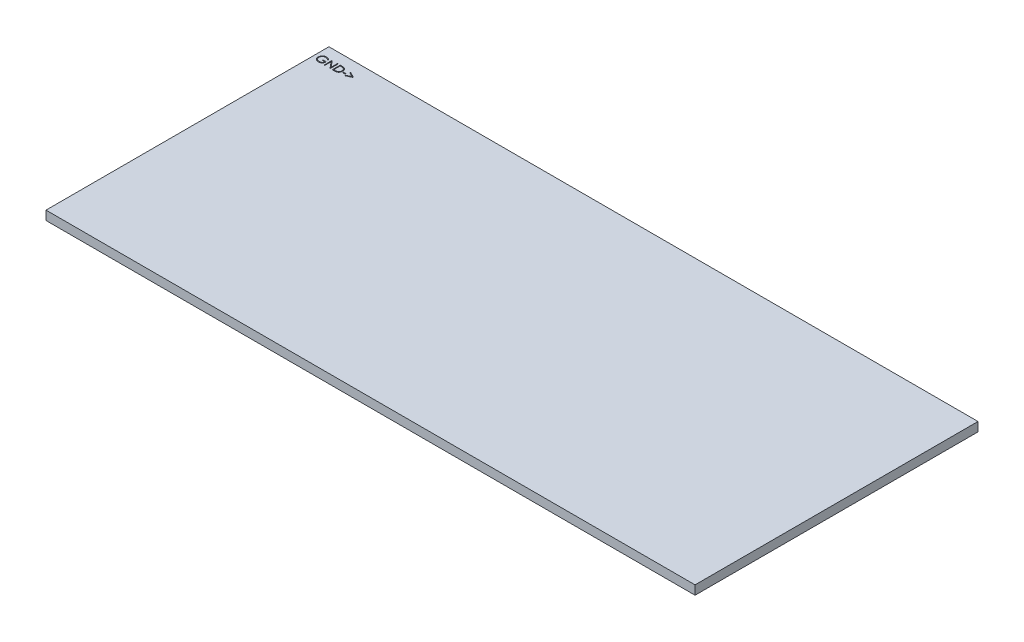
from build123d import *

# Parameters (mm, degrees)
SKETCH1_W           = 114.2
SKETCH1_H           = 49.784
BOSS_EXTRUDE1_DEPTH = 1.5875
SKETCH2_W           = 0.538461539
SKETCH2_H           = 0.143589744
CUT_EXTRUDE1_DEPTH  = 0.2
SKETCH5_W           = 0.538461539
SKETCH5_H           = 0.143589743
CUT_EXTRUDE2_DEPTH  = 0.2


with BuildPart() as part:
    # Sketch1 → Boss-Extrude1 (new body)
    with BuildSketch(Plane(origin=(0, 0, 0), x_dir=(1, 0, 0), z_dir=(0, 1, 0))):
        with Locations((57.1, 24.892)):
            Rectangle(SKETCH1_W, SKETCH1_H)
    extrude(amount=BOSS_EXTRUDE1_DEPTH)

    # Sketch2 → Cut-Extrude1 (cut)
    # profile 1 of 5: a face of its own
    with BuildSketch(Plane(origin=(0, 1.5875, 0), x_dir=(1, 0, 0), z_dir=(0, 1, 0))):
        with BuildLine():
            Line((1.979573781, 47.737471022), (1.871881473, 47.635387688))
            add(Edge.make_bspline(
                [(1.871881473, 47.635387688), (1.852393918, 47.653720034), (1.813883499, 47.689947579), (1.751099402, 47.736951977), (1.685593949, 47.777218417), (1.61770895, 47.809980911), (1.549125528, 47.836122016), (1.480754018, 47.854733272), (1.413295737, 47.866602287), (1.36842885, 47.868021634), (1.346320576, 47.868721022)],
                knots=[0, 0, 0, 0, 1.08915593, 2.152340314, 3.188132944, 4.216796309, 5.218260357, 6.173443236, 7.099959455, 8, 8, 8, 8], degree=3))
            add(Edge.make_bspline(
                [(1.346320576, 47.868721022), (1.332754696, 47.868555579), (1.30565812, 47.868225124), (1.265409342, 47.864007438), (1.225582687, 47.857941492), (1.186253337, 47.849164741), (1.147344823, 47.838041117), (1.108992466, 47.824126932), (1.071124724, 47.807904834), (1.034098292, 47.789159845), (0.99820209, 47.768567906), (0.964299356, 47.74574849), (0.932173996, 47.721432974), (0.902429826, 47.695012582), (0.874895752, 47.666726636), (0.848916403, 47.637101313), (0.825405484, 47.605327226), (0.804169018, 47.571988976), (0.785224371, 47.5376721), (0.76850091, 47.502706904), (0.754462074, 47.467209362), (0.743354292, 47.431134931), (0.734190031, 47.394762695), (0.727742988, 47.357840807), (0.724108299, 47.320329733), (0.723479587, 47.29521083), (0.723163525, 47.282583201)],
                knots=[0, 0, 0, 0, 1.02818874, 2.053710826, 3.065248034, 4.081641283, 5.106893873, 6.131558223, 7.173050175, 8.228653731, 9.27666206, 10.308777013, 11.325269123, 12.329503258, 13.32196095, 14.316845687, 15.314881793, 16.315733098, 17.311955233, 18.285320748, 19.252783886, 20.203351036, 21.145449891, 22.095197417, 23.042428769, 24, 24, 24, 24], degree=3))
            add(Edge.make_bspline(
                [(0.723163525, 47.282583201), (0.723465812, 47.269674874), (0.724069561, 47.243893469), (0.727933689, 47.20541584), (0.735104985, 47.167509679), (0.744692069, 47.130050426), (0.756684395, 47.092973926), (0.771633461, 47.056440922), (0.789339702, 47.020452766), (0.809834322, 46.985333719), (0.832308804, 46.95112451), (0.857486036, 46.918900701), (0.88423027, 46.88823319), (0.913515829, 46.859802885), (0.944403646, 46.832849326), (0.977816557, 46.808115117), (1.013097541, 46.785123828), (1.050300426, 46.76416522), (1.089021539, 46.745441806), (1.12872424, 46.728792248), (1.169535366, 46.715080513), (1.211240442, 46.703905271), (1.253789751, 46.694745152), (1.297399272, 46.68885216), (1.341748355, 46.684575828), (1.371643808, 46.68426316), (1.386705191, 46.684105637)],
                knots=[0, 0, 0, 0, 0.93586088, 1.869166235, 2.799637598, 3.729985548, 4.670839027, 5.622275134, 6.589130586, 7.576015415, 8.568469353, 9.55398029, 10.53834874, 11.515998671, 12.510579167, 13.508179873, 14.527009472, 15.561807829, 16.601455013, 17.643573243, 18.680854198, 19.719860599, 20.772568776, 21.833555941, 22.908541556, 24, 24, 24, 24], degree=3))
            add(Edge.make_bspline(
                [(1.386705191, 46.684105637), (1.40485653, 46.684485068), (1.440499633, 46.685230141), (1.49289421, 46.691030257), (1.543215438, 46.700088974), (1.59132192, 46.713355333), (1.637269528, 46.730276803), (1.681226705, 46.750674958), (1.722847368, 46.775332181), (1.762256637, 46.803161728), (1.798559512, 46.834167661), (1.831301161, 46.867625443), (1.859959357, 46.90337267), (1.884961237, 46.941198796), (1.905644698, 46.981416918), (1.922621816, 47.023829943), (1.935635133, 47.068456948), (1.940977123, 47.0992936), (1.943676345, 47.114874868)],
                knots=[0, 0, 0, 0, 1.13008108, 2.219097802, 3.278683437, 4.311054135, 5.322181354, 6.324827112, 7.324222904, 8.330512327, 9.32562643, 10.293043162, 11.24128371, 12.174520618, 13.111833804, 14.052305215, 15.015860969, 16, 16, 16, 16], degree=3))
            Line((1.943676345, 47.114874868), (1.477009678, 47.114874868))
            Line((1.477009678, 47.114874868), (1.477009678, 47.258464611))
            Line((1.477009678, 47.258464611), (2.069317371, 47.258464611))
            add(Edge.make_bspline(
                [(2.069317371, 47.258464611), (2.068635031, 47.231701616), (2.06729957, 47.179321599), (2.057932004, 47.102933491), (2.042805399, 47.030784814), (2.022141274, 46.962799585), (1.995391162, 46.899074148), (1.962842151, 46.839543801), (1.923973302, 46.784593129), (1.880169126, 46.733773527), (1.831009142, 46.688441843), (1.777821694, 46.648599467), (1.720518907, 46.615038421), (1.659154984, 46.587734156), (1.593930811, 46.566424558), (1.524695459, 46.551315928), (1.451542819, 46.542263942), (1.401408148, 46.541107391), (1.375767691, 46.540515893)],
                knots=[0, 0, 0, 0, 1.140356446, 2.231883559, 3.274166699, 4.278491846, 5.25512956, 6.21435461, 7.1637429, 8.11826594, 9.068280886, 10.0076534, 10.945064095, 11.891975133, 12.864533718, 13.863980011, 14.907571808, 16, 16, 16, 16], degree=3))
            add(Edge.make_bspline(
                [(1.375767691, 46.540515893), (1.359963637, 46.540743542), (1.328792949, 46.541192538), (1.282756578, 46.544383477), (1.237989529, 46.549295708), (1.194498326, 46.556713757), (1.152122989, 46.565799619), (1.111075155, 46.577434306), (1.071198458, 46.590901786), (1.032431264, 46.606220055), (0.995125445, 46.623968718), (0.959114838, 46.643692574), (0.924200388, 46.665289918), (0.890619922, 46.689134256), (0.858198473, 46.71504724), (0.827145096, 46.743080808), (0.797285945, 46.773149256), (0.778581759, 46.79450086), (0.769157114, 46.805259483)],
                knots=[0, 0, 0, 0, 1.107784379, 2.184907829, 3.233506516, 4.263428166, 5.276301166, 6.270063455, 7.25232949, 8.225834625, 9.190232166, 10.146266622, 11.1027726, 12.066435141, 13.031522626, 14.010570082, 14.99756817, 16, 16, 16, 16], degree=3))
            add(Edge.make_bspline(
                [(0.769157114, 46.805259483), (0.755482742, 46.822327744), (0.728360977, 46.856180951), (0.693449714, 46.910420929), (0.663689153, 46.966581673), (0.639542024, 47.024819524), (0.620686789, 47.08508001), (0.607164288, 47.147286126), (0.599241373, 47.211517978), (0.598099958, 47.254984084), (0.597522499, 47.276974227)],
                knots=[0, 0, 0, 0, 1.023165419, 2.029347347, 3.013907458, 3.994755782, 4.975994455, 5.96558838, 6.970761222, 8, 8, 8, 8], degree=3))
            add(Edge.make_bspline(
                [(0.597522499, 47.276974227), (0.597735394, 47.293440728), (0.598158479, 47.326164451), (0.603288685, 47.374747374), (0.610649253, 47.422467651), (0.621468074, 47.469286273), (0.63510658, 47.51523451), (0.652127975, 47.560333695), (0.671945933, 47.604610444), (0.694980132, 47.647759991), (0.720613915, 47.689209756), (0.748434004, 47.728792878), (0.778835444, 47.765788504), (0.811321763, 47.800665163), (0.84628056, 47.832984702), (0.883384329, 47.863046346), (0.922661666, 47.89089042), (0.964236138, 47.916078354), (1.007487212, 47.938703803), (1.052311212, 47.958539487), (1.098694457, 47.974932813), (1.146289448, 47.988842325), (1.195456448, 47.999128381), (1.245838663, 48.00658788), (1.297698708, 48.01169212), (1.332753119, 48.012102622), (1.350527307, 48.012310765)],
                knots=[0, 0, 0, 0, 1.008945113, 2.00506715, 2.99143336, 3.967273523, 4.948097931, 5.927297278, 6.919902385, 7.919676788, 8.923139349, 9.905703106, 10.883022732, 11.856032218, 12.825136022, 13.798837087, 14.781400844, 15.773989409, 16.776158564, 17.77167057, 18.775803737, 19.789618931, 20.80898985, 21.851988756, 22.910860228, 24, 24, 24, 24], degree=3))
            add(Edge.make_bspline(
                [(1.350527307, 48.012310765), (1.365022604, 48.012078969), (1.393765076, 48.011619343), (1.436535369, 48.008433484), (1.478644574, 48.003383931), (1.52015513, 47.996493217), (1.560925677, 47.98710774), (1.601072359, 47.975876427), (1.640653374, 47.962799698), (1.679544673, 47.947204159), (1.71800776, 47.929502709), (1.756256496, 47.90957734), (1.794160194, 47.887087338), (1.831784587, 47.861965924), (1.86936693, 47.834644557), (1.906312787, 47.804341827), (1.943513965, 47.772252725), (1.96743469, 47.749179852), (1.979573781, 47.737471022)],
                knots=[0, 0, 0, 0, 0.985871117, 1.954866573, 2.915460327, 3.869826059, 4.81536089, 5.759505086, 6.70452669, 7.649098992, 8.607881297, 9.583363685, 10.581137262, 11.603961102, 12.659522466, 13.73993555, 14.853081303, 16, 16, 16, 16], degree=3))
        make_face()
    # profile 2 of 5: a face of its own
    with BuildSketch(Plane(origin=(0, 1.5875, 0), x_dir=(1, 0, 0), z_dir=(0, 1, 0))):
        Polygon((2.356496858, 46.576413329), (2.356496858, 47.976413329), (2.382859037, 47.976413329), (3.307778909, 46.874530317), (3.307778909, 47.976413329), (3.433419935, 47.976413329), (3.433419935, 46.576413329), (3.404814166, 46.576413329), (2.482137884, 47.675772304), (2.482137884, 46.576413329), align=None)
    # profile 3 of 5: a face of its own
    with BuildSketch(Plane(origin=(0, 1.5875, 0), x_dir=(1, 0, 0), z_dir=(0, 1, 0))):
        with BuildLine():
            Line((3.792394294, 46.576413329), (3.792394294, 47.976413329))
            Line((3.792394294, 47.976413329), (4.075086602, 47.976413329))
            add(Edge.make_bspline(
                [(4.075086602, 47.976413329), (4.099674197, 47.976236301), (4.147177303, 47.975894284), (4.215822282, 47.973725728), (4.279335787, 47.969889541), (4.337508931, 47.964301731), (4.390501415, 47.957440517), (4.438164859, 47.948840356), (4.480745716, 47.938685088), (4.506933492, 47.930026907), (4.519317371, 47.92593256)],
                knots=[0, 0, 0, 0, 1.314313732, 2.53924729, 3.670748893, 4.714932338, 5.66265055, 6.526160246, 7.303039223, 8, 8, 8, 8], degree=3))
            add(Edge.make_bspline(
                [(4.519317371, 47.92593256), (4.535515266, 47.919760278), (4.567543743, 47.90755568), (4.613146592, 47.88453316), (4.656076738, 47.858447919), (4.696564396, 47.829265574), (4.733684726, 47.796159835), (4.768887885, 47.760537), (4.800733774, 47.721101664), (4.829897093, 47.678671669), (4.856191357, 47.633746848), (4.87904702, 47.586412805), (4.898028617, 47.536909921), (4.913785908, 47.485375862), (4.926204491, 47.431697311), (4.934677263, 47.375811765), (4.940265659, 47.317940089), (4.94082728, 47.278670303), (4.941112243, 47.25874506)],
                knots=[0, 0, 0, 0, 0.984719456, 1.947108742, 2.898477687, 3.838006223, 4.779231079, 5.722358779, 6.681677486, 7.655904652, 8.64651281, 9.637519902, 10.640069247, 11.656948941, 12.698408672, 13.768548281, 14.867775369, 16, 16, 16, 16], degree=3))
            add(Edge.make_bspline(
                [(4.941112243, 47.25874506), (4.940860656, 47.241440565), (4.940364877, 47.207340249), (4.935913151, 47.157083891), (4.929442623, 47.108318462), (4.919424944, 47.061276182), (4.907263938, 47.015544895), (4.891678278, 46.971611997), (4.873824079, 46.929074474), (4.853004128, 46.888507483), (4.830147574, 46.850074134), (4.805618877, 46.813843923), (4.779444198, 46.780333834), (4.751373945, 46.74944239), (4.721770859, 46.721216158), (4.690441126, 46.695419352), (4.657303906, 46.67255673), (4.622507617, 46.651729887), (4.585037165, 46.633561745), (4.544182819, 46.618189741), (4.499770348, 46.605451095), (4.451908765, 46.594822736), (4.400515374, 46.586391815), (4.345539787, 46.580741258), (4.287066472, 46.576920085), (4.246914765, 46.576585528), (4.226248461, 46.576413329)],
                knots=[0, 0, 0, 0, 1.105936401, 2.179363191, 3.223086493, 4.248585256, 5.251745608, 6.245858792, 7.225916811, 8.198733463, 9.158002045, 10.082870192, 10.993790845, 11.873723703, 12.748670949, 13.606408763, 14.465103618, 15.319838547, 16.196477973, 17.123216899, 18.106603292, 19.147568657, 20.255746949, 21.433717677, 22.679120308, 24, 24, 24, 24], degree=3))
            Line((4.226248461, 46.576413329), (3.792394294, 46.576413329))
        make_face()
        with BuildLine():
            Line((3.918035319, 46.720003073), (4.078732435, 46.720003073))
            add(Edge.make_bspline(
                [(4.078732435, 46.720003073), (4.101823783, 46.720102311), (4.146236903, 46.720293184), (4.210100101, 46.721968065), (4.26845186, 46.72470484), (4.321300464, 46.728534871), (4.368616074, 46.733602317), (4.410497573, 46.739252278), (4.446807677, 46.746291258), (4.468779452, 46.752671642), (4.478932755, 46.75562006)],
                knots=[0, 0, 0, 0, 1.375205317, 2.645023457, 3.804390687, 4.853969522, 5.800190428, 6.637939096, 7.370582563, 8, 8, 8, 8], degree=3))
            add(Edge.make_bspline(
                [(4.478932755, 46.75562006), (4.4917121, 46.760120683), (4.516965555, 46.769014433), (4.55331799, 46.785237497), (4.587220791, 46.804454325), (4.619264802, 46.825815235), (4.648995464, 46.850073635), (4.67676511, 46.876702031), (4.702517831, 46.905835941), (4.725987554, 46.937439206), (4.746990876, 46.971315124), (4.765179367, 47.007130657), (4.78111998, 47.044493381), (4.793631417, 47.083977045), (4.803437651, 47.125228668), (4.810383526, 47.168251154), (4.814709416, 47.213036466), (4.815213995, 47.243497316), (4.815471217, 47.259025509)],
                knots=[0, 0, 0, 0, 0.998632004, 1.973411704, 2.929992603, 3.868527914, 4.809262121, 5.754881198, 6.702106254, 7.672490631, 8.653608572, 9.636854334, 10.631411391, 11.644891563, 12.686317036, 13.754757253, 14.855430412, 16, 16, 16, 16], degree=3))
            add(Edge.make_bspline(
                [(4.815471217, 47.259025509), (4.815265902, 47.275398901), (4.814862559, 47.307564575), (4.809792835, 47.354760853), (4.802384213, 47.400153113), (4.791670738, 47.443744391), (4.778018387, 47.485619732), (4.76098053, 47.525547536), (4.741513882, 47.563949484), (4.718352547, 47.59993923), (4.69298631, 47.633976474), (4.664835158, 47.66515844), (4.634346343, 47.69355616), (4.601852403, 47.719611885), (4.566437563, 47.742277355), (4.528936087, 47.762552028), (4.488797819, 47.779758384), (4.46087274, 47.788909929), (4.446681153, 47.793560765)],
                knots=[0, 0, 0, 0, 1.122418816, 2.205001699, 3.251619955, 4.274784885, 5.280384055, 6.268708349, 7.249350384, 8.229342522, 9.199999885, 10.157847722, 11.105861043, 12.055065948, 13.010012805, 13.98527497, 14.976112212, 16, 16, 16, 16], degree=3))
            add(Edge.make_bspline(
                [(4.446681153, 47.793560765), (4.434940694, 47.796807336), (4.409977258, 47.803710437), (4.369241473, 47.811240586), (4.323395413, 47.817882386), (4.272235532, 47.823505602), (4.215820149, 47.82754053), (4.154105873, 47.830569056), (4.087066032, 47.832611709), (4.040593018, 47.832751192), (4.016472819, 47.832823586)],
                knots=[0, 0, 0, 0, 0.674548936, 1.434276114, 2.292660221, 3.240891867, 4.284742987, 5.42552168, 6.663806718, 8, 8, 8, 8], degree=3))
            Line((4.016472819, 47.832823586), (3.918035319, 47.832823586))
            Line((3.918035319, 47.832823586), (3.918035319, 46.720003073))
        make_face(mode=Mode.SUBTRACT)
    # profile 4 of 5: a face of its own
    with BuildSketch(Plane(origin=(0, 1.5875, 0), x_dir=(1, 0, 0), z_dir=(0, 1, 0))):
        with Locations((5.371881474, 47.114874868)):
            Rectangle(SKETCH2_W, SKETCH2_H)
    # profile 5 of 5: a face of its own
    with BuildSketch(Plane(origin=(0, 1.5875, 0), x_dir=(1, 0, 0), z_dir=(0, 1, 0))):
        Polygon((5.802650704, 46.892479034), (6.588468012, 47.26743897), (5.802650704, 47.642398906), (5.802650704, 47.778977432), (6.771881473, 47.316517496), (6.771881473, 47.218360445), (5.802650704, 46.755900509), align=None)
    extrude(amount=-CUT_EXTRUDE1_DEPTH, mode=Mode.SUBTRACT)

    # Sketch5 → Cut-Extrude2 (cut)
    # profile 1 of 5: a face of its own
    with BuildSketch(Plane.XZ):
        with BuildLine():
            Line((99.651881869, -8.835487078), (99.759574177, -8.733403745))
            add(Edge.make_bspline(
                [(99.759574177, -8.733403745), (99.779175842, -8.751710916), (99.8178077, -8.787791526), (99.880489648, -8.835127659), (99.945978993, -8.875362021), (100.013743302, -8.908417616), (100.082475826, -8.934112893), (100.150804316, -8.952691933), (100.218249726, -8.964640525), (100.263025991, -8.966044058), (100.285135074, -8.966737078)],
                knots=[0, 0, 0, 0, 1.091957225, 2.152079168, 3.193085318, 4.218301889, 5.218403563, 6.17723952, 7.099979378, 8, 8, 8, 8], degree=3))
            add(Edge.make_bspline(
                [(100.285135074, -8.966737078), (100.298700878, -8.966571391), (100.325797302, -8.966240448), (100.366047213, -8.962026398), (100.405869614, -8.955946802), (100.445127178, -8.947240762), (100.483975989, -8.935933089), (100.522329623, -8.92228076), (100.560114058, -8.905846268), (100.597130519, -8.887109443), (100.633199685, -8.866655116), (100.667122928, -8.843842484), (100.699041711, -8.81937356), (100.72873032, -8.79292744), (100.756595423, -8.764944288), (100.782126935, -8.735026497), (100.805883193, -8.703616878), (100.826975631, -8.670265196), (100.846040083, -8.635919084), (100.862548275, -8.600852326), (100.876762784, -8.565312239), (100.888121044, -8.529278791), (100.897252651, -8.492774989), (100.903716121, -8.455857867), (100.907346476, -8.418345536), (100.90797577, -8.393226801), (100.908292125, -8.380599258)],
                knots=[0, 0, 0, 0, 1.028307134, 2.053947307, 3.065600992, 4.082111276, 5.100671203, 6.132125737, 7.167228006, 8.222953114, 9.277225349, 10.309459149, 11.320441984, 12.324791754, 13.322338422, 14.312705492, 15.305176196, 16.306142747, 17.302479595, 18.282363326, 19.243345101, 20.20291386, 21.145121196, 22.094978082, 23.042318507, 24, 24, 24, 24], degree=3))
            add(Edge.make_bspline(
                [(100.908292125, -8.380599258), (100.907986948, -8.367691717), (100.907377426, -8.341911882), (100.90355646, -8.303422511), (100.896226075, -8.265583241), (100.887272098, -8.228037099), (100.874597988, -8.191263311), (100.859864729, -8.154723339), (100.842099723, -8.118756777), (100.821642921, -8.083614328), (100.79903596, -8.049415274), (100.774176335, -8.016930015), (100.747017095, -7.986538199), (100.718057578, -7.957795483), (100.687033563, -7.930883377), (100.653644155, -7.906126234), (100.618356717, -7.883141243), (100.581155602, -7.862180909), (100.54243401, -7.843457962), (100.502731437, -7.826808278), (100.461920277, -7.813096576), (100.42021521, -7.801921326), (100.377665899, -7.792761209), (100.334056378, -7.786868217), (100.289707295, -7.782591884), (100.259811842, -7.782279216), (100.244750459, -7.782121694)],
                knots=[0, 0, 0, 0, 0.935896426, 1.86923723, 2.799743935, 3.728471844, 4.66505513, 5.616527375, 6.583419551, 7.570341864, 8.562833498, 9.553750335, 10.533080376, 11.5155245, 12.510142773, 13.507781369, 14.526649666, 15.561487327, 16.601173999, 17.643331812, 18.680652164, 19.71969803, 20.772446191, 21.833473655, 22.9085001, 24, 24, 24, 24], degree=3))
            add(Edge.make_bspline(
                [(100.244750459, -7.782121694), (100.226599046, -7.782500967), (100.190955798, -7.783245731), (100.138562271, -7.78904808), (100.088237219, -7.798098666), (100.040144498, -7.811394295), (99.99410949, -7.828223243), (99.950302281, -7.849034791), (99.908600792, -7.873609274), (99.869189672, -7.901451642), (99.832990611, -7.932465136), (99.800087708, -7.96566017), (99.77144513, -8.00130161), (99.746876082, -8.039381697), (99.725729206, -8.079339717), (99.708860621, -8.121860543), (99.695813584, -8.16646924), (99.6904762, -8.197308393), (99.687779305, -8.212890924)],
                knots=[0, 0, 0, 0, 1.130234505, 2.219399076, 3.279128566, 4.311639422, 5.322903917, 6.328167287, 7.327698761, 8.334124803, 9.329374007, 10.292761544, 11.24113083, 12.171311216, 13.111441694, 14.052040787, 15.015727358, 16, 16, 16, 16], degree=3))
            Line((99.687779305, -8.212890924), (100.154445972, -8.212890924))
            Line((100.154445972, -8.212890924), (100.154445972, -8.356480668))
            Line((100.154445972, -8.356480668), (99.562138279, -8.356480668))
            add(Edge.make_bspline(
                [(99.562138279, -8.356480668), (99.562820619, -8.329717672), (99.56415608, -8.277337656), (99.573523646, -8.200949547), (99.588650251, -8.12880087), (99.609314376, -8.060815641), (99.636064488, -7.997090204), (99.668613499, -7.937559858), (99.707482348, -7.882609185), (99.751286524, -7.831789584), (99.800446508, -7.786457899), (99.853633956, -7.746615524), (99.910936743, -7.713054478), (99.972300666, -7.685750213), (100.037524839, -7.664440615), (100.106760191, -7.649331984), (100.179912831, -7.640279999), (100.230047502, -7.639123447), (100.255687959, -7.63853195)],
                knots=[0, 0, 0, 0, 1.140356446, 2.231883559, 3.274166699, 4.278491846, 5.25512956, 6.21435461, 7.1637429, 8.11826594, 9.068280886, 10.0076534, 10.945064095, 11.891975133, 12.864533718, 13.863980011, 14.907571808, 16, 16, 16, 16], degree=3))
            add(Edge.make_bspline(
                [(100.255687959, -7.63853195), (100.271492013, -7.638759598), (100.302662701, -7.639208595), (100.348699072, -7.642399534), (100.393466121, -7.647311764), (100.436957324, -7.654729814), (100.479332661, -7.663815675), (100.520380495, -7.675450363), (100.560257192, -7.688917842), (100.599024386, -7.704236112), (100.636330205, -7.721984774), (100.672340812, -7.74170863), (100.707255262, -7.763305975), (100.740835728, -7.787150313), (100.773257177, -7.813063297), (100.804310554, -7.841096865), (100.834169705, -7.871165312), (100.852873891, -7.892516916), (100.862298536, -7.90327554)],
                knots=[0, 0, 0, 0, 1.107784379, 2.184907829, 3.233506516, 4.263428166, 5.276301166, 6.270063455, 7.25232949, 8.225834625, 9.190232166, 10.146266622, 11.1027726, 12.066435141, 13.031522626, 14.010570082, 14.99756817, 16, 16, 16, 16], degree=3))
            add(Edge.make_bspline(
                [(100.862298536, -7.90327554), (100.875972908, -7.920343801), (100.903094674, -7.954197008), (100.938005936, -8.008436986), (100.967766497, -8.06459773), (100.991913626, -8.122835581), (101.010768861, -8.183096066), (101.024291362, -8.245302183), (101.032214277, -8.309534035), (101.033355692, -8.353000141), (101.033933151, -8.374990283)],
                knots=[0, 0, 0, 0, 1.023165419, 2.029347347, 3.013907458, 3.994755782, 4.975994455, 5.96558838, 6.970761222, 8, 8, 8, 8], degree=3))
            add(Edge.make_bspline(
                [(101.033933151, -8.374990283), (101.033719679, -8.391456611), (101.033295448, -8.42417999), (101.028173727, -8.47276546), (101.020781417, -8.52047621), (101.01007394, -8.567356417), (100.995985583, -8.613197952), (100.979066009, -8.658353059), (100.959248376, -8.702641257), (100.936121924, -8.745670006), (100.910949049, -8.787424593), (100.882642549, -8.826590782), (100.852774898, -8.863925885), (100.819915174, -8.898372873), (100.785294704, -8.931032189), (100.748052355, -8.961043033), (100.708799142, -8.988911744), (100.667218109, -9.014092978), (100.623968813, -9.036720242), (100.579144337, -9.056555441), (100.532761221, -9.072948898), (100.485166195, -9.086858374), (100.435999204, -9.09714444), (100.385616987, -9.104603936), (100.333756942, -9.109708176), (100.298702531, -9.110118678), (100.280928343, -9.110326822)],
                knots=[0, 0, 0, 0, 1.009025537, 2.005226976, 2.991671811, 3.967589759, 4.950148279, 5.929425679, 6.922109907, 7.921964004, 8.922507644, 9.908469609, 10.882248289, 11.851158214, 12.824245259, 13.798023939, 14.780666017, 15.773333703, 16.775582742, 17.771174102, 18.775387309, 19.789283316, 20.80873549, 21.851817535, 22.910773411, 24, 24, 24, 24], degree=3))
            add(Edge.make_bspline(
                [(100.280928343, -9.110326822), (100.26643294, -9.110095604), (100.237690258, -9.109637127), (100.194921517, -9.10644279), (100.152898044, -9.101435908), (100.111409034, -9.094434621), (100.070612458, -9.085173054), (100.030384717, -9.073885883), (99.990801895, -9.060817521), (99.951911081, -9.045219734), (99.913447862, -9.027518898), (99.875199162, -9.00759336), (99.837295454, -8.985103405), (99.799671064, -8.959981978), (99.76208872, -8.932660614), (99.725142863, -8.902357884), (99.687941685, -8.870268782), (99.66402096, -8.847195908), (99.651881869, -8.835487078)],
                knots=[0, 0, 0, 0, 0.985875312, 1.954874891, 2.915472732, 3.863573565, 4.815313299, 5.759461513, 6.704487138, 7.649063459, 8.607849844, 9.583336382, 10.581114205, 11.603942397, 12.659508253, 13.739925933, 14.853076422, 16, 16, 16, 16], degree=3))
        make_face()
    # profile 2 of 5: a face of its own
    with BuildSketch(Plane.XZ):
        Polygon((99.274958792, -7.674429386), (99.274958792, -9.074429386), (99.248596613, -9.074429386), (98.323676741, -7.972546373), (98.323676741, -9.074429386), (98.198035715, -9.074429386), (98.198035715, -7.674429386), (98.226641484, -7.674429386), (99.149317766, -8.77378836), (99.149317766, -7.674429386), align=None)
    # profile 3 of 5: a face of its own
    with BuildSketch(Plane.XZ):
        with BuildLine():
            Line((97.839061356, -7.674429386), (97.839061356, -9.074429386))
            Line((97.839061356, -9.074429386), (97.556369049, -9.074429386))
            add(Edge.make_bspline(
                [(97.556369049, -9.074429386), (97.531781402, -9.07425284), (97.484278197, -9.073911755), (97.415633903, -9.071736737), (97.352210986, -9.067927977), (97.294045464, -9.062273052), (97.24104389, -9.055485557), (97.19329115, -9.046853559), (97.150709859, -9.036701744), (97.124522134, -9.028043157), (97.112138279, -9.023948617)],
                knots=[0, 0, 0, 0, 1.314317071, 2.539253741, 3.67075822, 4.709970291, 5.662644612, 6.526156501, 7.303037452, 8, 8, 8, 8], degree=3))
            add(Edge.make_bspline(
                [(97.112138279, -9.023948617), (97.095938935, -9.01777825), (97.063907594, -9.005577439), (97.018325773, -8.982527115), (96.975270052, -8.95651688), (96.935080401, -8.92695041), (96.897668262, -8.894205528), (96.862562912, -8.858547168), (96.830770578, -8.819023372), (96.801194735, -8.776860547), (96.775308199, -8.731675004), (96.752481249, -8.684371804), (96.732990499, -8.635042727), (96.717782479, -8.583327844), (96.705218026, -8.529723854), (96.696787586, -8.47382491), (96.691187584, -8.415956907), (96.69062756, -8.376686616), (96.690343407, -8.356761117)],
                knots=[0, 0, 0, 0, 0.984696416, 1.947063185, 2.89840987, 3.841051395, 4.778753227, 5.721858861, 6.681155121, 7.65838316, 8.646299769, 9.637283673, 10.641736726, 11.657050558, 12.698485921, 13.768600492, 14.86780186, 16, 16, 16, 16], degree=3))
            add(Edge.make_bspline(
                [(96.690343407, -8.356761117), (96.690595164, -8.33945668), (96.691091277, -8.30535648), (96.695540574, -8.255099282), (96.70201998, -8.206336922), (96.712005463, -8.159283512), (96.724275393, -8.113622254), (96.739419615, -8.069569347), (96.757369363, -8.02709485), (96.778185973, -7.986536127), (96.800979311, -7.947991801), (96.825816395, -7.912072583), (96.851846819, -7.878382447), (96.880019959, -7.847682491), (96.909403032, -7.81901671), (96.940995396, -7.793656719), (96.973807857, -7.770425187), (97.008826197, -7.750027616), (97.046337728, -7.73188337), (97.087322305, -7.716560446), (97.131630345, -7.703373928), (97.179555443, -7.692867812), (97.230937763, -7.684399351), (97.285916592, -7.67875979), (97.344388979, -7.674935464), (97.384540817, -7.674601354), (97.40520719, -7.674429386)],
                knots=[0, 0, 0, 0, 1.105894396, 2.179280415, 3.222964075, 4.248423888, 5.251546139, 6.243661943, 7.223682738, 8.196462441, 9.155694589, 10.083899862, 10.986397372, 11.874737962, 12.745335529, 13.607670254, 14.461432187, 15.313100333, 16.195087267, 17.121790994, 18.106827133, 19.14775296, 20.255889161, 21.433815148, 22.679170477, 24, 24, 24, 24], degree=3))
            Line((97.40520719, -7.674429386), (97.839061356, -7.674429386))
        make_face()
        with BuildLine():
            Line((97.713420331, -7.818019129), (97.552723215, -7.818019129))
            add(Edge.make_bspline(
                [(97.552723215, -7.818019129), (97.529631867, -7.818118368), (97.485218748, -7.81830924), (97.421355549, -7.819984121), (97.36300379, -7.822720896), (97.310155186, -7.826550927), (97.262839577, -7.831618374), (97.220958077, -7.837268335), (97.184647973, -7.844307315), (97.162676198, -7.850687699), (97.152522895, -7.853636117)],
                knots=[0, 0, 0, 0, 1.375205317, 2.645023457, 3.804390687, 4.853969522, 5.800190428, 6.637939096, 7.370582563, 8, 8, 8, 8], degree=3))
            add(Edge.make_bspline(
                [(97.152522895, -7.853636117), (97.139743278, -7.858136404), (97.114489286, -7.867029488), (97.078140779, -7.883257415), (97.04422349, -7.902456304), (97.012171983, -7.923923343), (96.982192242, -7.947990006), (96.954423101, -7.974732828), (96.928645218, -8.003842203), (96.905271322, -8.035416216), (96.884131488, -8.069104538), (96.86586674, -8.104869642), (96.850469765, -8.142510828), (96.83783757, -8.181897134), (96.82798879, -8.223052004), (96.821054861, -8.266078715), (96.816757987, -8.310960274), (96.816245096, -8.341513656), (96.815984433, -8.357041565)],
                knots=[0, 0, 0, 0, 0.998420628, 1.972994, 2.929372424, 3.86770908, 4.81360496, 5.759023883, 6.706048443, 7.676227424, 8.651287839, 9.634325482, 10.632389399, 11.645655052, 12.680158286, 13.74837235, 14.855672678, 16, 16, 16, 16], degree=3))
            add(Edge.make_bspline(
                [(96.815984433, -8.357041565), (96.816189967, -8.373414859), (96.81659374, -8.405580341), (96.821660362, -8.452778008), (96.829080224, -8.498165233), (96.839753118, -8.541774691), (96.853541577, -8.583549646), (96.870040585, -8.623726107), (96.890072971, -8.661787044), (96.912751749, -8.698054816), (96.938212831, -8.731980172), (96.966343273, -8.763165658), (96.996846456, -8.791669364), (97.0295818, -8.817536675), (97.065007001, -8.840307574), (97.102522595, -8.860564211), (97.142657039, -8.877775454), (97.170582643, -8.886926327), (97.184774497, -8.891576822)],
                knots=[0, 0, 0, 0, 1.122272916, 2.204715076, 3.251197285, 4.274229216, 5.279697671, 6.265416158, 7.248880903, 8.225321784, 9.195852973, 10.153576302, 11.101466393, 12.055578741, 13.010401466, 13.985536859, 14.976245305, 16, 16, 16, 16], degree=3))
            add(Edge.make_bspline(
                [(97.184774497, -8.891576822), (97.196514956, -8.894823393), (97.221478392, -8.901726494), (97.262214177, -8.909256643), (97.308060237, -8.915898443), (97.359220118, -8.921521658), (97.415635501, -8.925556587), (97.477349777, -8.928585113), (97.544389618, -8.930627766), (97.590862632, -8.930767249), (97.614982831, -8.930839642)],
                knots=[0, 0, 0, 0, 0.674548936, 1.434276114, 2.292660221, 3.240891867, 4.284742987, 5.42552168, 6.663806718, 8, 8, 8, 8], degree=3))
            Line((97.614982831, -8.930839642), (97.713420331, -8.930839642))
            Line((97.713420331, -8.930839642), (97.713420331, -7.818019129))
        make_face(mode=Mode.SUBTRACT)
    # profile 4 of 5: a face of its own
    with BuildSketch(Plane.XZ):
        with Locations((96.259574177, -8.212890924)):
            Rectangle(SKETCH5_W, SKETCH5_H)
    # profile 5 of 5: a face of its own
    with BuildSketch(Plane.XZ):
        Polygon((95.828804946, -7.990495091), (95.042987638, -8.365455027), (95.828804946, -8.740414963), (95.828804946, -8.876993488), (94.859574177, -8.414533553), (94.859574177, -8.316376501), (95.828804946, -7.853916565), align=None)
    extrude(amount=-CUT_EXTRUDE2_DEPTH, mode=Mode.SUBTRACT)


solid = part.part
